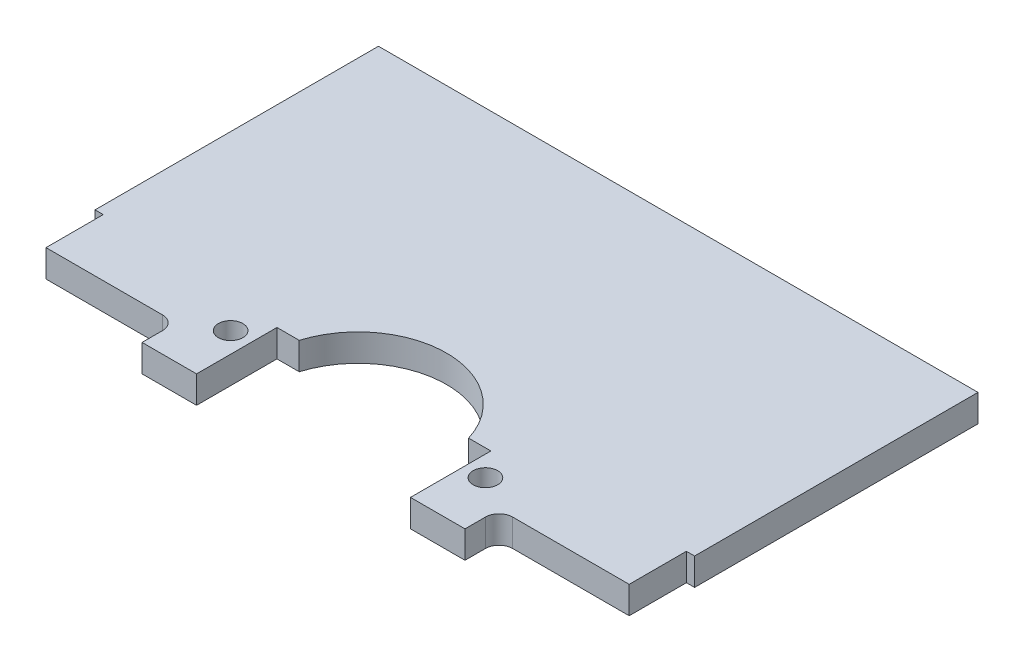
from build123d import *

# Parameters (mm, degrees)
SKETCH1_R           = 1.143
BOSS_EXTRUDE1_DEPTH = 2.54
FILLET1_R           = 1.27


with BuildPart() as part:
    # Sketch1 → Boss-Extrude1 (new body)
    with BuildSketch(Plane(origin=(0, 0, 0), x_dir=(1, 0, 0), z_dir=(0, 1, 0))):
        with BuildLine():
            Line((-27.94, 13.208), (-27.94, -13.208))
            Line((-27.94, -13.208), (-27.178, -13.208))
            Line((-27.178, -13.208), (-27.178, -18.542))
            Line((-27.178, -18.542), (-15.0495, -18.542))
            Line((-15.0495, -18.542), (-15.0495, -21.717))
            Line((-15.0495, -21.717), (-9.9695, -21.717))
            Line((-9.9695, -21.717), (-9.9695, -14.224))
            Line((-9.9695, -14.224), (-7.894457296, -14.224))
            ThreePointArc((-7.894457296, -14.224), (0, -8.382), (7.894457296, -14.224))
            Line((7.894457296, -14.224), (9.9695, -14.224))
            Line((9.9695, -14.224), (9.9695, -21.717))
            Line((9.9695, -21.717), (15.0495, -21.717))
            Line((15.0495, -21.717), (15.0495, -18.542))
            Line((15.0495, -18.542), (27.178, -18.542))
            Line((27.178, -18.542), (27.178, -13.208))
            Line((27.178, -13.208), (27.94, -13.208))
            Line((27.94, -13.208), (27.94, 13.208))
            Line((27.94, 13.208), (-27.94, 13.208))
        make_face()
        with Locations((11.8745, -16.637)):
            Circle(SKETCH1_R, mode=Mode.SUBTRACT)
        with Locations((-11.8745, -16.637)):
            Circle(SKETCH1_R, mode=Mode.SUBTRACT)
    extrude(amount=BOSS_EXTRUDE1_DEPTH)

    # Fillet1
    fillet1_edges = [part.edges().sort_by_distance(p)[0] for p in [
        (-15.0495, 1.27, 18.542),
        (15.0495, 1.27, 18.542),
    ]]
    fillet(fillet1_edges, radius=FILLET1_R)


solid = part.part
